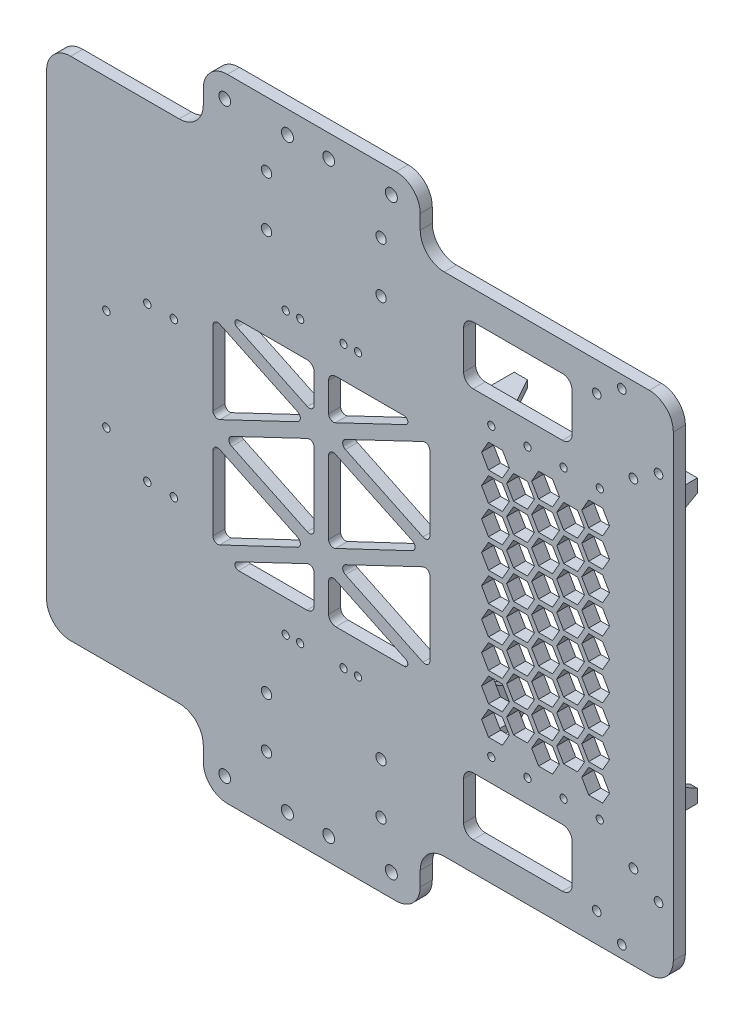
from build123d import *

# Parameters (mm, degrees)
EXTRUDE_1_DEPTH       = 5
EXTRUDE_2_DEPTH       = 20
CUT_EXTRUDE_3_DEPTH   = 10
CUT_EXTRUDE_4_DEPTH   = 10
MIRROR_2_COPY_1_DEPTH = 20
MIRROR_2_COPY_2_DEPTH = 10
MIRROR_2_COPY_3_DEPTH = 10
MIRROR_2_COPY_4_DEPTH = 20
MIRROR_2_COPY_5_DEPTH = 10
MIRROR_2_COPY_6_DEPTH = 10
CUT_EXTRUDE_5_DEPTH   = 5
SKETCH_9_W            = 45
SKETCH_9_H            = 24
CUT_EXTRUDE_6_DEPTH   = 5
FILLET_1_R            = 4
FILLET_2_R            = 1.5
FILLET_3_R            = 2
FILLET_4_R            = 3
SKETCH_10_R           = 1.8
SKETCH_10_R_2         = 1.55
SKETCH_10_R_3         = 2.5
SKETCH_10_R_4         = 2.45
SKETCH_10_R_5         = 1.5
SKETCH_10_R_6         = 2.15
CUT_EXTRUDE_7_DEPTH   = 186.636742053


with BuildPart() as part:
    # 草图1 → 凸台-拉伸1 (new body)
    with BuildSketch(Plane.XY):
        with BuildLine():
            Line((-130, 95), (-130, -95))
            ThreePointArc((-130, -95), (-127.071067812, -102.071067812), (-120, -105))
            Line((-120, -105), (-75, -105))
            ThreePointArc((-75, -105), (-67.928932188, -107.928932188), (-65, -115))
            Line((-65, -115), (-65, -121))
            ThreePointArc((-65, -121), (-62.071067812, -128.071067812), (-55, -131))
            Line((-55, -131), (15, -131))
            ThreePointArc((15, -131), (22.071067812, -128.071067812), (25, -121))
            Line((25, -121), (25, -115))
            ThreePointArc((25, -115), (27.928932188, -107.928932188), (35, -105))
            Line((35, -105), (120, -105))
            ThreePointArc((120, -105), (127.071067812, -102.071067812), (130, -95))
            Line((130, -95), (130, 95))
            ThreePointArc((130, 95), (127.071067812, 102.071067812), (120, 105))
            Line((120, 105), (35, 105))
            ThreePointArc((35, 105), (27.928932188, 107.928932188), (25, 115))
            Line((25, 115), (25, 121))
            ThreePointArc((25, 121), (22.071067812, 128.071067812), (15, 131))
            Line((15, 131), (-55, 131))
            ThreePointArc((-55, 131), (-62.071067812, 128.071067812), (-65, 121))
            Line((-65, 121), (-65, 115))
            ThreePointArc((-65, 115), (-67.928932188, 107.928932188), (-75, 105))
            Line((-75, 105), (-120, 105))
            ThreePointArc((-120, 105), (-127.071067812, 102.071067812), (-130, 95))
        make_face()
    extrude(amount=EXTRUDE_1_DEPTH)

    # 草图4 → 凸台-拉伸2 (add)
    with BuildSketch(Plane(origin=(0, 0, 0), x_dir=(-1, 0, 0), z_dir=(0, 0, -1))):
        Polygon((-39, -47.5), (-39, -58.5), (-50, -58.5), (-50, -55.5), (-42, -55.5), (-42, -47.5), align=None)
    extrude_2 = extrude(amount=EXTRUDE_2_DEPTH)

    # 草图5 → 切除-拉伸3 (cut)
    with BuildSketch(Plane.XZ.offset(58.5)):
        Polygon((50, -10), (44.5, -20), (50, -20), align=None)
    cut_extrude_3 = extrude(amount=-CUT_EXTRUDE_3_DEPTH, mode=Mode.SUBTRACT)

    # 草图6 → 切除-拉伸4 (cut)
    with BuildSketch(Plane.ZY.offset(-39)):
        Polygon((-20, -53), (-10, -47.5), (-20, -47.5), align=None)
    cut_extrude_4 = extrude(amount=-CUT_EXTRUDE_4_DEPTH, mode=Mode.SUBTRACT)

    # 镜向1: 凸台-拉伸2, 切除-拉伸3, 切除-拉伸4 across plane
    add(extrude_2.mirror(Plane(origin=(77, 0, 0), x_dir=(0, 0, 1), z_dir=(1, 0, 0))))
    add(cut_extrude_3.mirror(Plane(origin=(77, 0, 0), x_dir=(0, 0, 1), z_dir=(1, 0, 0))), mode=Mode.SUBTRACT)
    add(cut_extrude_4.mirror(Plane(origin=(77, 0, 0), x_dir=(0, 0, 1), z_dir=(1, 0, 0))), mode=Mode.SUBTRACT)

    # 镜向2 copy 1 sketch → 镜向2 copy 1 (add)
    with BuildSketch(Plane(origin=(154, 0, 0), x_dir=(1, 0, 0), z_dir=(0, 0, -1))):
        Polygon((-39, -47.5), (-39, -58.5), (-50, -58.5), (-50, -55.5), (-42, -55.5), (-42, -47.5), align=None)
    extrude(amount=MIRROR_2_COPY_1_DEPTH)

    # 镜向2 copy 2 sketch → 镜向2 copy 2 (cut)
    with BuildSketch(Plane(origin=(154, 58.5, 0), x_dir=(-1, 0, 0), z_dir=(0, 1, 0))):
        Polygon((50, -10), (44.5, -20), (50, -20), align=None)
    extrude(amount=-MIRROR_2_COPY_2_DEPTH, mode=Mode.SUBTRACT)

    # 镜向2 copy 3 sketch → 镜向2 copy 3 (cut)
    with BuildSketch(Plane(origin=(115, 0, 0), x_dir=(0, 0, 1), z_dir=(1, 0, 0))):
        Polygon((-20, -53), (-10, -47.5), (-20, -47.5), align=None)
    extrude(amount=-MIRROR_2_COPY_3_DEPTH, mode=Mode.SUBTRACT)

    # 镜向2 copy 4 sketch → 镜向2 copy 4 (add)
    with BuildSketch(Plane(origin=(0, 0, 0), x_dir=(-1, 0, 0), z_dir=(0, 0, -1))):
        Polygon((-39, 47.5), (-39, 58.5), (-50, 58.5), (-50, 55.5), (-42, 55.5), (-42, 47.5), align=None)
    extrude(amount=MIRROR_2_COPY_4_DEPTH)

    # 镜向2 copy 5 sketch → 镜向2 copy 5 (cut)
    with BuildSketch(Plane(origin=(0, 58.5, 0), x_dir=(1, 0, 0), z_dir=(0, 1, 0))):
        Polygon((50, 10), (44.5, 20), (50, 20), align=None)
    extrude(amount=-MIRROR_2_COPY_5_DEPTH, mode=Mode.SUBTRACT)

    # 镜向2 copy 6 sketch → 镜向2 copy 6 (cut)
    with BuildSketch(Plane.ZY.offset(-39)):
        Polygon((-20, 53), (-10, 47.5), (-20, 47.5), align=None)
    extrude(amount=-MIRROR_2_COPY_6_DEPTH, mode=Mode.SUBTRACT)

    # 草图7 → 切除-拉伸5 (cut)
    with BuildSketch(Plane(origin=(0, 0, 0), x_dir=(-1, 0, 0), z_dir=(0, 0, -1))):
        Polygon((-92.012994616, 36), (-94.899745962, 41), (-100.673248654, 41), (-103.56, 36), (-100.673248654, 31), (-94.899745962, 31), align=None)
        Polygon((-74.115136271, 31), (-71.228384925, 36), (-74.115136271, 41), (-79.888638963, 41), (-82.775390309, 36), (-79.888638963, 31), align=None)
        Polygon((-92.012994616, 24), (-94.899745962, 29), (-100.673248654, 29), (-103.56, 24), (-100.673248654, 19), (-94.899745962, 19), align=None)
        Polygon((-93.167695155, 30), (-90.280943809, 25), (-84.507441117, 25), (-81.620689771, 30), (-84.507441117, 35), (-90.280943809, 35), align=None)
        Polygon((-84.507441117, 37), (-81.620689771, 42), (-84.507441117, 47), (-90.280943809, 47), (-93.167695155, 42), (-90.280943809, 37), align=None)
        Polygon((-79.888638963, 43), (-74.115136271, 43), (-71.228384925, 48), (-74.115136271, 53), (-79.888638963, 53), (-82.775390309, 48), align=None)
        Polygon((-94.899745962, 43), (-92.012994616, 48), (-94.899745962, 53), (-100.673248654, 53), (-103.56, 48), (-100.673248654, 43), align=None)
        Polygon((-72.383085464, 42), (-69.496334118, 37), (-63.722831426, 37), (-60.83608008, 42), (-63.722831426, 47), (-69.496334118, 47), align=None)
        Polygon((-93.167695155, 18), (-90.280943809, 13), (-84.507441117, 13), (-81.620689771, 18), (-84.507441117, 23), (-90.280943809, 23), align=None)
        Polygon((-74.115136271, 19), (-71.228384925, 24), (-74.115136271, 29), (-79.888638963, 29), (-82.775390309, 24), (-79.888638963, 19), align=None)
        Polygon((-72.383085464, 30), (-69.496334118, 25), (-63.722831426, 25), (-60.83608008, 30), (-63.722831426, 35), (-69.496334118, 35), align=None)
        Polygon((-92.012994616, 12), (-94.899745962, 17), (-100.673248654, 17), (-103.56, 12), (-100.673248654, 7), (-94.899745962, 7), align=None)
        Polygon((-93.167695155, 6), (-90.280943809, 1), (-84.507441117, 1), (-81.620689771, 6), (-84.507441117, 11), (-90.280943809, 11), align=None)
        Polygon((-74.115136271, 7), (-71.228384925, 12), (-74.115136271, 17), (-79.888638963, 17), (-82.775390309, 12), (-79.888638963, 7), align=None)
        Polygon((-72.383085464, 18), (-69.496334118, 13), (-63.722831426, 13), (-60.83608008, 18), (-63.722831426, 23), (-69.496334118, 23), align=None)
        Polygon((-92.012994616, 0), (-94.899745962, 5), (-100.673248654, 5), (-103.56, 0), (-100.673248654, -5), (-94.899745962, -5), align=None)
        Polygon((-93.167695155, -6), (-90.280943809, -11), (-84.507441117, -11), (-81.620689771, -6), (-84.507441117, -1), (-90.280943809, -1), align=None)
        Polygon((-74.115136271, -5), (-71.228384925, 0), (-74.115136271, 5), (-79.888638963, 5), (-82.775390309, 0), (-79.888638963, -5), align=None)
        Polygon((-72.383085464, 6), (-69.496334118, 1), (-63.722831426, 1), (-60.83608008, 6), (-63.722831426, 11), (-69.496334118, 11), align=None)
        Polygon((-92.012994616, -12), (-94.899745962, -7), (-100.673248654, -7), (-103.56, -12), (-100.673248654, -17), (-94.899745962, -17), align=None)
        Polygon((-93.167695155, -18), (-90.280943809, -23), (-84.507441117, -23), (-81.620689771, -18), (-84.507441117, -13), (-90.280943809, -13), align=None)
        Polygon((-74.115136271, -17), (-71.228384925, -12), (-74.115136271, -7), (-79.888638963, -7), (-82.775390309, -12), (-79.888638963, -17), align=None)
        Polygon((-72.383085464, -6), (-69.496334118, -11), (-63.722831426, -11), (-60.83608008, -6), (-63.722831426, -1), (-69.496334118, -1), align=None)
        Polygon((-92.012994616, -24), (-94.899745962, -19), (-100.673248654, -19), (-103.56, -24), (-100.673248654, -29), (-94.899745962, -29), align=None)
        Polygon((-93.167695155, -30), (-90.280943809, -35), (-84.507441117, -35), (-81.620689771, -30), (-84.507441117, -25), (-90.280943809, -25), align=None)
        Polygon((-74.115136271, -29), (-71.228384925, -24), (-74.115136271, -19), (-79.888638963, -19), (-82.775390309, -24), (-79.888638963, -29), align=None)
        Polygon((-72.383085464, -18), (-69.496334118, -23), (-63.722831426, -23), (-60.83608008, -18), (-63.722831426, -13), (-69.496334118, -13), align=None)
        Polygon((-92.012994616, -36), (-94.899745962, -31), (-100.673248654, -31), (-103.56, -36), (-100.673248654, -41), (-94.899745962, -41), align=None)
        Polygon((-93.167695155, -42), (-90.280943809, -47), (-84.507441117, -47), (-81.620689771, -42), (-84.507441117, -37), (-90.280943809, -37), align=None)
        Polygon((-74.115136271, -41), (-71.228384925, -36), (-74.115136271, -31), (-79.888638963, -31), (-82.775390309, -36), (-79.888638963, -41), align=None)
        Polygon((-72.383085464, -30), (-69.496334118, -35), (-63.722831426, -35), (-60.83608008, -30), (-63.722831426, -25), (-69.496334118, -25), align=None)
        Polygon((-92.012994616, -48), (-94.899745962, -43), (-100.673248654, -43), (-103.56, -48), (-100.673248654, -53), (-94.899745962, -53), align=None)
        Polygon((-74.115136271, -53), (-71.228384925, -48), (-74.115136271, -43), (-79.888638963, -43), (-82.775390309, -48), (-79.888638963, -53), align=None)
        Polygon((-72.383085464, -42), (-69.496334118, -47), (-63.722831426, -47), (-60.83608008, -42), (-63.722831426, -37), (-69.496334118, -37), align=None)
        Polygon((-61.990780618, 36), (-59.104029272, 31), (-53.330526581, 31), (-50.443775235, 36), (-53.330526581, 41), (-59.104029272, 41), align=None)
        Polygon((-61.990780618, 48), (-59.104029272, 43), (-53.330526581, 43), (-50.443775235, 48), (-53.330526581, 53), (-59.104029272, 53), align=None)
        Polygon((-61.990780618, 24), (-59.104029272, 19), (-53.330526581, 19), (-50.443775235, 24), (-53.330526581, 29), (-59.104029272, 29), align=None)
        Polygon((-61.990780618, 12), (-59.104029272, 7), (-53.330526581, 7), (-50.443775235, 12), (-53.330526581, 17), (-59.104029272, 17), align=None)
        Polygon((-61.990780618, 0), (-59.104029272, -5), (-53.330526581, -5), (-50.443775235, 0), (-53.330526581, 5), (-59.104029272, 5), align=None)
        Polygon((-61.990780618, -12), (-59.104029272, -17), (-53.330526581, -17), (-50.443775235, -12), (-53.330526581, -7), (-59.104029272, -7), align=None)
        Polygon((-61.990780618, -24), (-59.104029272, -29), (-53.330526581, -29), (-50.443775235, -24), (-53.330526581, -19), (-59.104029272, -19), align=None)
        Polygon((-61.990780618, -36), (-59.104029272, -41), (-53.330526581, -41), (-50.443775235, -36), (-53.330526581, -31), (-59.104029272, -31), align=None)
        Polygon((-61.990780618, -48), (-59.104029272, -53), (-53.330526581, -53), (-50.443775235, -48), (-53.330526581, -43), (-59.104029272, -43), align=None)
    extrude(amount=-CUT_EXTRUDE_5_DEPTH, mode=Mode.SUBTRACT)

    # 草图9 → 切除-拉伸6 (cut)
    with BuildSketch(Plane(origin=(0, 0, 0), x_dir=(-1, 0, 0), z_dir=(0, 0, -1))):
        Polygon((9.804878049, 22.5), (-29, 41), (-29, 4), align=None)
        Polygon((13, -26.88372093), (-25, -45), (13, -45), align=None)
        Polygon((22.074593576, -22.557461202), (61, -41), (61, -4), align=None)
        Polygon((19, 26.88372093), (57, 45), (19, 45), align=None)
        Polygon((19, -18.11627907), (57, 0), (19, 18.11627907), align=None)
        with Locations((-65.5, 81)):
            Rectangle(SKETCH_9_W, SKETCH_9_H)
        with Locations((-65.5, -81)):
            Rectangle(SKETCH_9_W, SKETCH_9_H)
        Polygon((13, 45), (-25, 45), (13, 26.88372093), align=None)
        Polygon((61, 4), (61, 41), (22.074593576, 22.557461202), align=None)
        Polygon((13, 18.257993079), (-25.535898385, 0), (13, -18.257993079), align=None)
        Polygon((19, -45), (57, -45), (19, -26.88372093), align=None)
        Polygon((-29, -41), (9.804878049, -22.5), (-29, -4), align=None)
    extrude(amount=-CUT_EXTRUDE_6_DEPTH, mode=Mode.SUBTRACT)

    # 圆角1
    fillet_1_edges = [part.edges().sort_by_distance(p)[0] for p in [
        (43, -93, 2.5),
        (88, -69, 2.5),
        (43, -69, 2.5),
        (88, -93, 2.5),
        (88, 69, 2.5),
        (43, 69, 2.5),
        (43, 93, 2.5),
        (88, 93, 2.5),
    ]]
    fillet(fillet_1_edges, radius=FILLET_1_R)

    # 圆角2
    fillet_2_edges = [part.edges().sort_by_distance(p)[0] for p in [
        (25, -45, 2.5),
        (-57, -45, 2.5),
        (25, 45, 2.5),
        (-57, 45, 2.5),
    ]]
    fillet(fillet_2_edges, radius=FILLET_2_R)

    # 圆角3
    fillet_3_edges = [part.edges().sort_by_distance(p)[0] for p in [
        (29, -4, 2.5),
        (29, 4, 2.5),
        (-13, -18.257993079, 2.5),
        (-61, -41, 2.5),
        (-61, 4, 2.5),
        (-13, -26.88372093, 2.5),
        (-13, 18.257993079, 2.5),
        (-61, -4, 2.5),
        (-22.074593576, -22.557461202, 2.5),
        (25.535898385, 0, 2.5),
        (-22.074593576, 22.557461202, 2.5),
        (-61, 41, 2.5),
        (-19, 26.88372093, 2.5),
        (-19, -26.88372093, 2.5),
        (-19, -18.11627907, 2.5),
        (29, -41, 2.5),
        (29, 41, 2.5),
        (-57, 0, 2.5),
        (-9.804878049, -22.5, 2.5),
        (-13, 26.88372093, 2.5),
        (-9.804878049, 22.5, 2.5),
        (-19, 18.11627907, 2.5),
    ]]
    fillet(fillet_3_edges, radius=FILLET_3_R)

    # 圆角4
    fillet_4_edges = [part.edges().sort_by_distance(p)[0] for p in [
        (-13, -45, 2.5),
        (-13, 45, 2.5),
        (-19, -45, 2.5),
        (-19, 45, 2.5),
    ]]
    fillet(fillet_4_edges, radius=FILLET_4_R)

    # 草图10 → 切除-拉伸7 (cut, through all)
    with BuildSketch(Plane(origin=(0, 0, 0), x_dir=(-1, 0, 0), z_dir=(0, 0, -1))):
        with Locations((-123.874270778, 76.959685144)):
            Circle(SKETCH_10_R)
        with Locations((-113.46869275, 70.033362462)):
            Circle(SKETCH_10_R)
        with Locations((-108.636360878, 99.851956806)):
            Circle(SKETCH_10_R)
        with Locations((-98.23078285, 92.925634125)):
            Circle(SKETCH_10_R)
        with Locations((105.210066138, 21)):
            Circle(SKETCH_10_R_2)
        with Locations((88.210066138, 32)):
            Circle(SKETCH_10_R_2)
        with Locations((77.210066138, 32)):
            Circle(SKETCH_10_R_2)
        with Locations((-13.026746603, 121.678975654)):
            Circle(SKETCH_10_R_3)
        with Locations((56.094087389, 121.678975654)):
            Circle(SKETCH_10_R_4)
        with Locations((30.094087389, 121.678975654)):
            Circle(SKETCH_10_R_3)
        with Locations((12.973253397, 121.678975654)):
            Circle(SKETCH_10_R_4)
        with Locations((12.973253397, -121.678975654)):
            Circle(SKETCH_10_R_4)
        with Locations((30.094087389, -121.678975654)):
            Circle(SKETCH_10_R_3)
        with Locations((56.094087389, -121.678975654)):
            Circle(SKETCH_10_R_4)
        with Locations((-13.026746603, -121.678975654)):
            Circle(SKETCH_10_R_3)
        with Locations((77.210066138, -32)):
            Circle(SKETCH_10_R_2)
        with Locations((88.210066138, -32)):
            Circle(SKETCH_10_R_2)
        with Locations((105.210066138, -21)):
            Circle(SKETCH_10_R_2)
        with Locations((-98.23078285, -92.925634125)):
            Circle(SKETCH_10_R)
        with Locations((-108.636360878, -99.851956806)):
            Circle(SKETCH_10_R)
        with Locations((-113.46869275, -70.033362462)):
            Circle(SKETCH_10_R)
        with Locations((-123.874270778, -76.959685144)):
            Circle(SKETCH_10_R)
        with Locations((-99.5, 59.5)):
            Circle(SKETCH_10_R_5)
        with Locations((-84.5, 59.5)):
            Circle(SKETCH_10_R_5)
        with Locations((-69.5, 59.5)):
            Circle(SKETCH_10_R_5)
        with Locations((-54.5, 59.5)):
            Circle(SKETCH_10_R_5)
        with Locations((0.806057342, 58.25)):
            Circle(SKETCH_10_R_5)
        with Locations((6.806057342, 58.25)):
            Circle(SKETCH_10_R_5)
        with Locations((24.806057342, 58.25)):
            Circle(SKETCH_10_R_5)
        with Locations((30.806057342, 58.25)):
            Circle(SKETCH_10_R_5)
        with Locations((30.806057342, -58.25)):
            Circle(SKETCH_10_R_5)
        with Locations((24.806057342, -58.25)):
            Circle(SKETCH_10_R_5)
        with Locations((6.806057342, -58.25)):
            Circle(SKETCH_10_R_5)
        with Locations((0.806057342, -58.25)):
            Circle(SKETCH_10_R_5)
        with Locations((-54.5, -59.5)):
            Circle(SKETCH_10_R_5)
        with Locations((-69.5, -59.5)):
            Circle(SKETCH_10_R_5)
        with Locations((-84.5, -59.5)):
            Circle(SKETCH_10_R_5)
        with Locations((-99.5, -59.5)):
            Circle(SKETCH_10_R_5)
        with Locations((-8.75, 83.16647484)):
            Circle(SKETCH_10_R_6)
        with Locations((38.75, 83.16647484)):
            Circle(SKETCH_10_R_6)
        with Locations((38.75, 104.16647484)):
            Circle(SKETCH_10_R_6)
        with Locations((-8.75, 104.16647484)):
            Circle(SKETCH_10_R_6)
        with Locations((-8.75, -104.16647484)):
            Circle(SKETCH_10_R_6)
        with Locations((38.75, -104.16647484)):
            Circle(SKETCH_10_R_6)
        with Locations((38.75, -83.16647484)):
            Circle(SKETCH_10_R_6)
        with Locations((-8.75, -83.16647484)):
            Circle(SKETCH_10_R_6)
    extrude(amount=-CUT_EXTRUDE_7_DEPTH, mode=Mode.SUBTRACT)


solid = part.part
